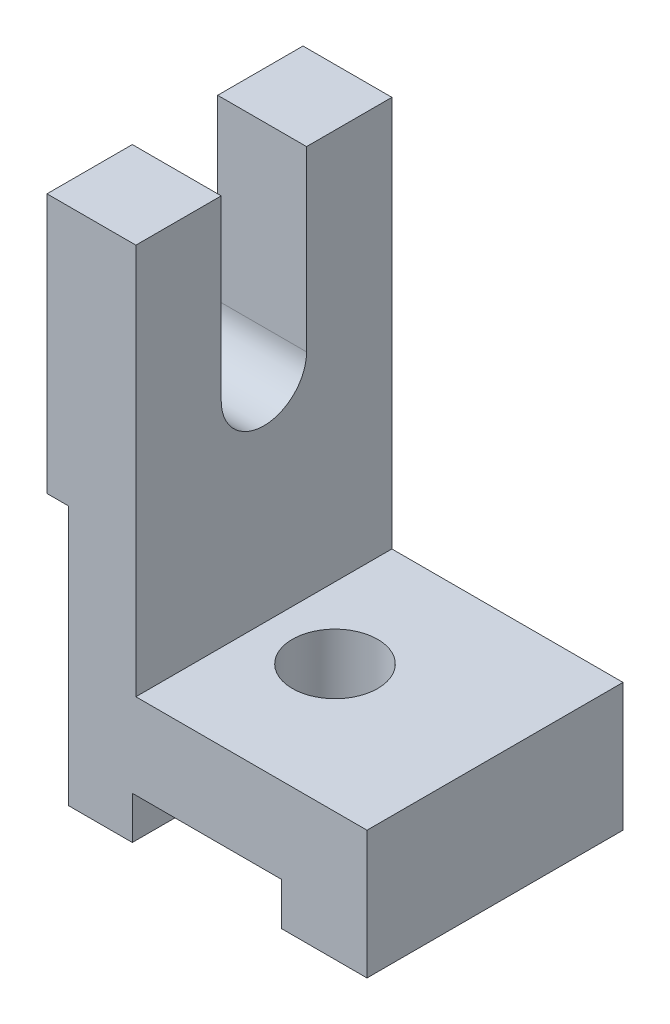
from build123d import *

# Parameters (mm, degrees)
BOSS_EXTRUDE1_DEPTH = 36
CUT_EXTRUDE1_DEPTH  = 90
SKETCH3_W           = 82.490949764
SKETCH3_H           = 73
CUT_EXTRUDE2_DEPTH  = 6
SKETCH4_R           = 12
CUT_EXTRUDE3_DEPTH  = 12
SKETCH4_2_R         = 12
CUT_EXTRUDE4_DEPTH  = 176.248395142


with BuildPart() as part:
    # Sketch1 → Boss-Extrude1 (new, symmetric)
    with BuildSketch(Plane.XY):
        Polygon((0, 134), (0, -12), (24, -12), (24, 0), (66, 0), (66, -12), (90, -12), (90, 24), (25, 24), (25, 134), align=None)
    extrude(amount=BOSS_EXTRUDE1_DEPTH, both=True)

    # Sketch2 → Cut-Extrude1 (cut)
    with BuildSketch(Plane.ZY):
        with BuildLine():
            Line((-12, 84), (-12, 134))
            Line((-12, 134), (12, 134))
            Line((12, 134), (12, 84))
            ThreePointArc((12, 84), (0, 72), (-12, 84))
        make_face()
    extrude(amount=-CUT_EXTRUDE1_DEPTH, mode=Mode.SUBTRACT)

    # Sketch3 → Cut-Extrude2 (cut)
    with BuildSketch(Plane.ZY):
        with Locations((27.245474882, 24.5)):
            Rectangle(SKETCH3_W, SKETCH3_H)
    extrude(amount=-CUT_EXTRUDE2_DEPTH, mode=Mode.SUBTRACT)

    # Sketch4 → Cut-Extrude3 (cut)
    with BuildSketch(Plane.XZ.offset(12)):
        with BuildLine():
            Line((66, 36), (66, 11.618950039))
            ThreePointArc((66, 11.618950039), (69, 0), (66, -11.618950039))
            Line((66, -11.618950039), (66, -36))
            Line((66, -36), (24, -36))
            Line((24, -36), (24, -11.618950039))
            ThreePointArc((24, -11.618950039), (21, 0), (24, 11.618950039))
            Line((24, 11.618950039), (24, 36))
            Line((24, 36), (66, 36))
        make_face()
        with Locations((45, 0)):
            Circle(SKETCH4_R, mode=Mode.SUBTRACT)
    extrude(amount=-CUT_EXTRUDE3_DEPTH, mode=Mode.SUBTRACT)

    # Sketch4<2> → Cut-Extrude4 (cut, through all)
    with BuildSketch(Plane.XZ.offset(12)):
        with Locations((45, 0)):
            Circle(SKETCH4_2_R)
    extrude(amount=-CUT_EXTRUDE4_DEPTH, mode=Mode.SUBTRACT)


solid = part.part
